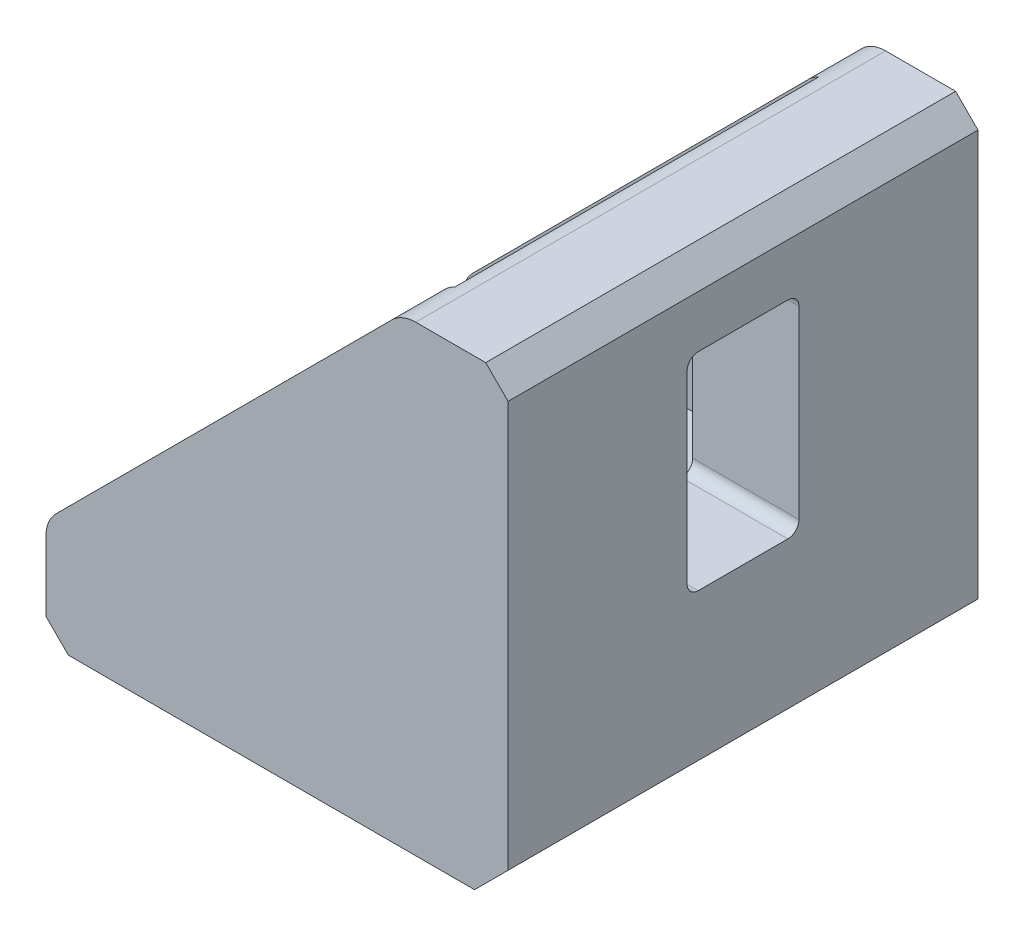
from build123d import *

# Parameters (mm, degrees)
BOSS_EXTRUDE1_DEPTH = 42
BOSS_EXTRUDE2_DEPTH = 4.75
CUT_EXTRUDE1_DEPTH  = 9.5
CUT_EXTRUDE2_DEPTH  = 9.5
FILLET6_R           = 2
FILLET7_START       = -1
FILLET7_DEPTH       = 44
FILLET8_START       = -1
FILLET8_DEPTH       = 44
CHAMFER1_SIZE       = 2
CHAMFER2_SIZE       = 3
CHAMFER3_SIZE       = 2


with BuildPart() as part:
    # Sketch1 → Boss-Extrude1 (new body)
    with BuildSketch(Plane.XY):
        Polygon((0, 0), (-41.3, 0), (-41.3, 9.5), (-9.5, 9.5), (-9.5, 41.3), (0, 41.3), align=None)
    extrude(amount=BOSS_EXTRUDE1_DEPTH)

    # Sketch2 → Boss-Extrude2 (add)
    with BuildSketch(Plane.XY.offset(42)):
        Polygon((-41.3, 9.5), (-9.5, 41.3), (-9.5, 9.5), align=None)
    boss_extrude2 = extrude(amount=-BOSS_EXTRUDE2_DEPTH)

    # Mirror1: Boss-Extrude2 across plane
    add(boss_extrude2.mirror(Plane.XY.offset(21)))

    # Sketch3 → Cut-Extrude1 (cut)
    with BuildSketch(Plane.ZY.offset(9.5)):
        with BuildLine():
            Line((17, 16.15), (25, 16.15))
            ThreePointArc((25, 16.15), (25.707106781, 16.442893219), (26, 17.15))
            Line((26, 17.15), (26, 33.65))
            ThreePointArc((26, 33.65), (25.707106781, 34.357106781), (25, 34.65))
            Line((25, 34.65), (17, 34.65))
            ThreePointArc((17, 34.65), (16.292893219, 34.357106781), (16, 33.65))
            Line((16, 33.65), (16, 17.15))
            ThreePointArc((16, 17.15), (16.292893219, 16.442893219), (17, 16.15))
        make_face()
    extrude(amount=-CUT_EXTRUDE1_DEPTH, mode=Mode.SUBTRACT)

    # Sketch4 → Cut-Extrude2 (cut)
    with BuildSketch(Plane(origin=(0, 9.5, 0), x_dir=(1, 0, 0), z_dir=(0, 1, 0))):
        with BuildLine():
            Line((-33.65, -26), (-17.15, -26))
            ThreePointArc((-17.15, -26), (-16.442893219, -25.707106781), (-16.15, -25))
            Line((-16.15, -25), (-16.15, -17))
            ThreePointArc((-16.15, -17), (-16.442893219, -16.292893219), (-17.15, -16))
            Line((-17.15, -16), (-33.65, -16))
            ThreePointArc((-33.65, -16), (-34.357106781, -16.292893219), (-34.65, -17))
            Line((-34.65, -17), (-34.65, -25))
            ThreePointArc((-34.65, -25), (-34.357106781, -25.707106781), (-33.65, -26))
        make_face()
    extrude(amount=-CUT_EXTRUDE2_DEPTH, mode=Mode.SUBTRACT)

    # Fillet6
    fillet6_edges = [part.edges().sort_by_distance(p)[0] for p in [
        (-9.5, 9.5, 21),
    ]]
    fillet(fillet6_edges, radius=FILLET6_R)

    # Fillet7: read off the stored shape, not the designer's step
    # Fillet7 outline → Fillet7 (cut)
    with BuildSketch(Plane.XY.offset(FILLET7_START)):
        with BuildLine():
            Line((-9.5, 41.3), (-10.378679656, 40.421320344))
            ThreePointArc((-10.378679656, 40.421320344), (-9.40540961, 41.071638598), (-8.257359313, 41.3))
            Line((-8.257359313, 41.3), (-9.5, 41.3))
        make_face()
    extrude(amount=FILLET7_DEPTH, mode=Mode.SUBTRACT)

    # Fillet8: read off the stored shape, not the designer's step
    # Fillet8 outline → Fillet8 (cut)
    with BuildSketch(Plane.XY.offset(FILLET8_START)):
        with BuildLine():
            Line((-40.421320344, 10.378679656), (-41.3, 9.5))
            Line((-41.3, 9.5), (-41.3, 8.257359313))
            ThreePointArc((-41.3, 8.257359313), (-41.071638598, 9.40540961), (-40.421320344, 10.378679656))
        make_face()
    extrude(amount=FILLET8_DEPTH, mode=Mode.SUBTRACT)

    # Chamfer1
    chamfer1_edges = [part.edges().sort_by_distance(p)[0] for p in [
        (0, 41.3, 21),
    ]]
    chamfer(chamfer1_edges, length=CHAMFER1_SIZE)

    # Chamfer2
    chamfer2_edges = [part.edges().sort_by_distance(p)[0] for p in [
        (0, 0, 21),
    ]]
    chamfer(chamfer2_edges, length=CHAMFER2_SIZE)

    # Chamfer3
    chamfer3_edges = [part.edges().sort_by_distance(p)[0] for p in [
        (-41.3, 0, 21),
    ]]
    chamfer(chamfer3_edges, length=CHAMFER3_SIZE)


solid = part.part
